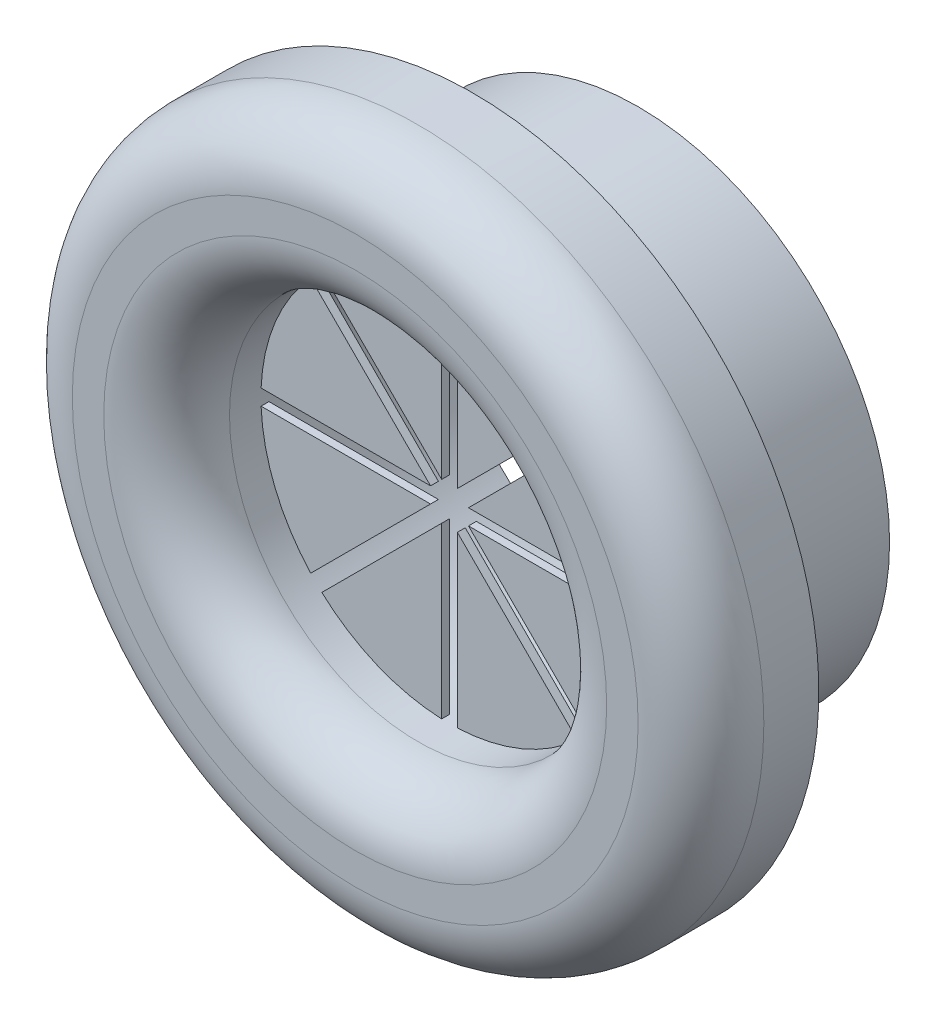
from build123d import *

# Parameters (mm, degrees)
SZKIC1_R                    = 8
DODANIE_WYCI_GNI_CIE1_DEPTH = 5
SZKIC2_R                    = 11
DODANIE_WYCI_GNI_CIE2_DEPTH = 4
SZKIC3_R                    = 6
WYTNIJ_WYCI_GNI_CIE1_DEPTH  = 18.972200756
ZAOKR_GLENIE1_R             = 2
DODANIE_WYCI_GNI_CIE3_DEPTH = 0.25
SZYK_KO_OWY1_COUNT          = 8
SZKIC5_R                    = 11
SZKIC5_R_2                  = 10
WYTNIJ_WYCI_GNI_CIE2_DEPTH  = 0.25


with BuildPart() as part:
    # Szkic1 → Dodanie-wyciągnięcie1 (new body)
    with BuildSketch(Plane.XY):
        Circle(SZKIC1_R)
    extrude(amount=DODANIE_WYCI_GNI_CIE1_DEPTH)

    # Szkic2 → Dodanie-wyciągnięcie2 (add)
    with BuildSketch(Plane.XY.offset(5)):
        Circle(SZKIC2_R)
    extrude(amount=DODANIE_WYCI_GNI_CIE2_DEPTH)

    # Szkic3 → Wytnij-wyciągnięcie1 (cut, through all)
    with BuildSketch(Plane.XY.offset(9)):
        Circle(SZKIC3_R)
    extrude(amount=-WYTNIJ_WYCI_GNI_CIE1_DEPTH, mode=Mode.SUBTRACT)

    # Zaokrąglenie1
    zaokr_glenie1_edges = [part.edges().sort_by_distance(p)[0] for p in [
        (-6, 0, 9),
        (-11, 0, 9),
    ]]
    fillet(zaokr_glenie1_edges, radius=ZAOKR_GLENIE1_R)

    # Szkic4 → Dodanie-wyciągnięcie3 (add)
    with BuildSketch(Plane(origin=(0, 0, 6), x_dir=(-1, 0, 0), z_dir=(0, 0, -1))):
        with BuildLine():
            Line((4.415732935, -4.062179544), (0.603553391, -0.25))
            Line((0.603553391, -0.25), (5.994789404, -0.25))
            ThreePointArc((5.994789404, -0.25), (5.543277195, -2.296100594), (4.415732935, -4.062179544))
        make_face()
    dodanie_wyci_gni_cie3 = extrude(amount=DODANIE_WYCI_GNI_CIE3_DEPTH)

    # Szyk kołowy1: Dodanie-wyciągnięcie3 ×8 about axis
    szyk_ko_owy1_axis = Axis((0, 0, 7), (0, 0, 1))
    for i in range(1, SZYK_KO_OWY1_COUNT):
        add(dodanie_wyci_gni_cie3.rotate(szyk_ko_owy1_axis, i * 360 / SZYK_KO_OWY1_COUNT))

    # Szkic5 → Wytnij-wyciągnięcie2 (cut)
    with BuildSketch(Plane(origin=(0, 0, 5), x_dir=(-1, 0, 0), z_dir=(0, 0, -1))):
        Circle(SZKIC5_R)
        Circle(SZKIC5_R_2, mode=Mode.SUBTRACT)
    extrude(amount=-WYTNIJ_WYCI_GNI_CIE2_DEPTH, mode=Mode.SUBTRACT)


solid = part.part
